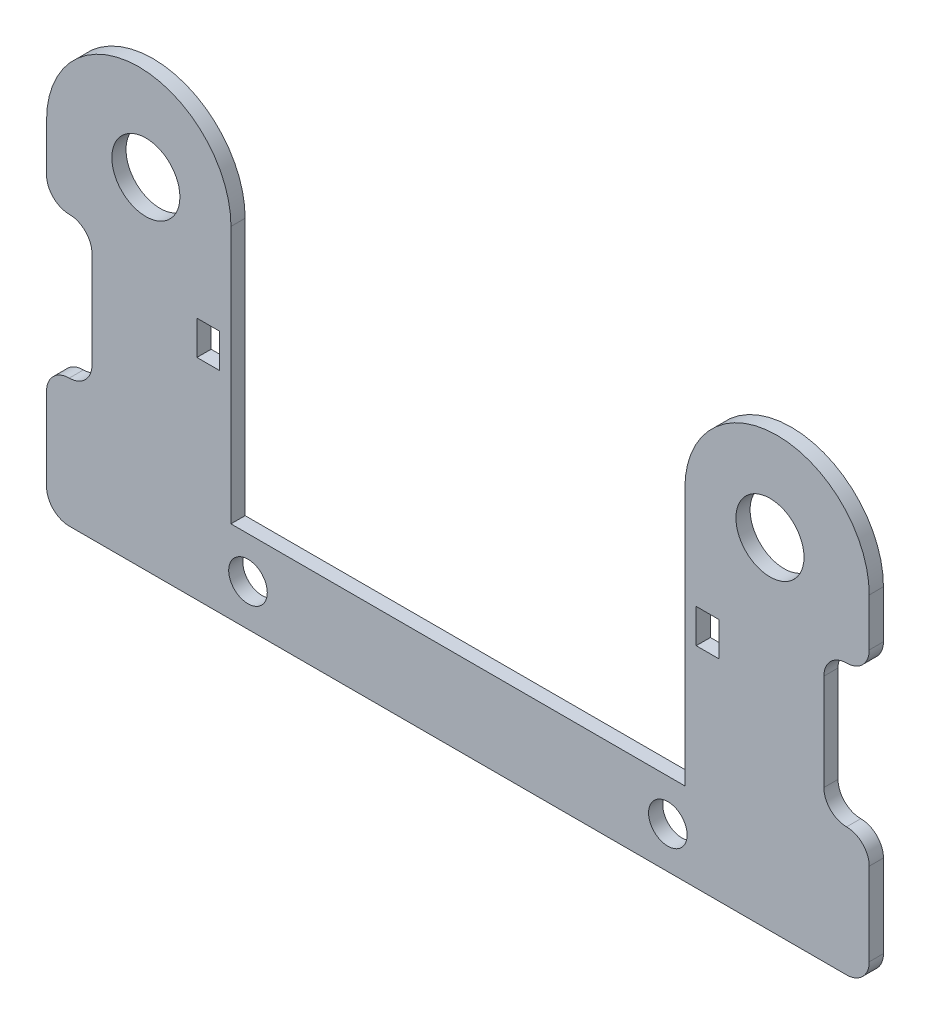
from build123d import *

# Parameters (mm, degrees)
SKETCH1_R           = 2.159
SKETCH1_R_2         = 3.81
BOSS_EXTRUDE1_DEPTH = 1.5875
FILLET1_R           = 2.54
SKETCH2_W           = 5.08
SKETCH2_H           = 15.875
SKETCH2_W_2         = 2.54
SKETCH2_H_2         = 3.81
CUT_EXTRUDE1_DEPTH  = 1.5875
FILLET2_START       = -1
FILLET2_DEPTH       = 4
FILLET2_2_DEPTH     = 1.5875


with BuildPart() as part:
    # Sketch1 → Boss-Extrude1 (new body)
    with BuildSketch(Plane.XY):
        with BuildLine():
            Line((0, 38.1), (0, 0))
            Line((0, 0), (92.075, 0))
            Line((92.075, 0), (92.075, 38.1))
            ThreePointArc((92.075, 38.1), (81.75625, 48.41875), (71.4375, 38.1))
            Line((71.4375, 38.1), (71.4375, 9.271))
            Line((71.4375, 9.271), (20.6375, 9.271))
            Line((20.6375, 9.271), (20.6375, 38.1))
            ThreePointArc((20.6375, 38.1), (10.31875, 48.41875), (0, 38.1))
        make_face()
        with Locations((22.5425, 4.6355)):
            Circle(SKETCH1_R, mode=Mode.SUBTRACT)
        with Locations((69.5325, 4.6355)):
            Circle(SKETCH1_R, mode=Mode.SUBTRACT)
        with Locations((11.1125, 38.1)):
            Circle(SKETCH1_R_2, mode=Mode.SUBTRACT)
        with Locations((80.9625, 38.1)):
            Circle(SKETCH1_R_2, mode=Mode.SUBTRACT)
    extrude(amount=BOSS_EXTRUDE1_DEPTH)

    # Fillet1
    fillet1_edges = [part.edges().sort_by_distance(p)[0] for p in [
        (92.075, 0, 0.79375),
        (0, 0, 0.79375),
    ]]
    fillet(fillet1_edges, radius=FILLET1_R)

    # Sketch2 → Cut-Extrude1 (cut)
    with BuildSketch(Plane.XY.offset(1.5875)):
        with Locations((89.535, 22.2885)):
            Rectangle(SKETCH2_W, SKETCH2_H)
        with Locations((2.54, 22.2885)):
            Rectangle(SKETCH2_W, SKETCH2_H)
        with Locations((18.0975, 25.4)):
            Rectangle(SKETCH2_W_2, SKETCH2_H_2)
        with Locations((73.9775, 25.4)):
            Rectangle(SKETCH2_W_2, SKETCH2_H_2)
    extrude(amount=-CUT_EXTRUDE1_DEPTH, mode=Mode.SUBTRACT)

    # Fillet2: read off the stored shape, not the designer's step
    # Fillet2 outline → Fillet2 (cut)
    with BuildSketch(Plane.XY.offset(FILLET2_START)):
        with BuildLine():
            Line((92.075, 14.351), (89.535, 14.351))
            ThreePointArc((89.535, 14.351), (91.331051224, 13.607051224), (92.075, 11.811))
            Line((92.075, 11.811), (92.075, 14.351))
        make_face()
        with BuildLine():
            ThreePointArc((92.075, 32.766), (91.331051224, 30.969948776), (89.535, 30.226))
            Line((89.535, 30.226), (92.075, 30.226))
            Line((92.075, 30.226), (92.075, 32.766))
        make_face()
        with BuildLine():
            Line((0, 30.226), (2.54, 30.226))
            ThreePointArc((2.54, 30.226), (0.743948776, 30.969948776), (0, 32.766))
            Line((0, 32.766), (0, 30.226))
        make_face()
        with BuildLine():
            ThreePointArc((0, 11.811), (0.743948776, 13.607051224), (2.54, 14.351))
            Line((2.54, 14.351), (0, 14.351))
            Line((0, 14.351), (0, 11.811))
        make_face()
    extrude(amount=FILLET2_DEPTH, mode=Mode.SUBTRACT)

    # Fillet2 2 outline → Fillet2 2 (add)
    with BuildSketch(Plane.XY):
        with BuildLine():
            ThreePointArc((89.535, 14.351), (87.738948776, 15.094948776), (86.995, 16.891))
            Line((86.995, 16.891), (86.995, 14.351))
            Line((86.995, 14.351), (89.535, 14.351))
        make_face()
        with BuildLine():
            ThreePointArc((86.995, 27.686), (87.738948776, 29.482051224), (89.535, 30.226))
            Line((89.535, 30.226), (86.995, 30.226))
            Line((86.995, 30.226), (86.995, 27.686))
        make_face()
        with BuildLine():
            ThreePointArc((2.54, 30.226), (4.336051224, 29.482051224), (5.08, 27.686))
            Line((5.08, 27.686), (5.08, 30.226))
            Line((5.08, 30.226), (2.54, 30.226))
        make_face()
        with BuildLine():
            ThreePointArc((5.08, 16.891), (4.336051224, 15.094948776), (2.54, 14.351))
            Line((2.54, 14.351), (5.08, 14.351))
            Line((5.08, 14.351), (5.08, 16.891))
        make_face()
    extrude(amount=FILLET2_2_DEPTH)


solid = part.part
